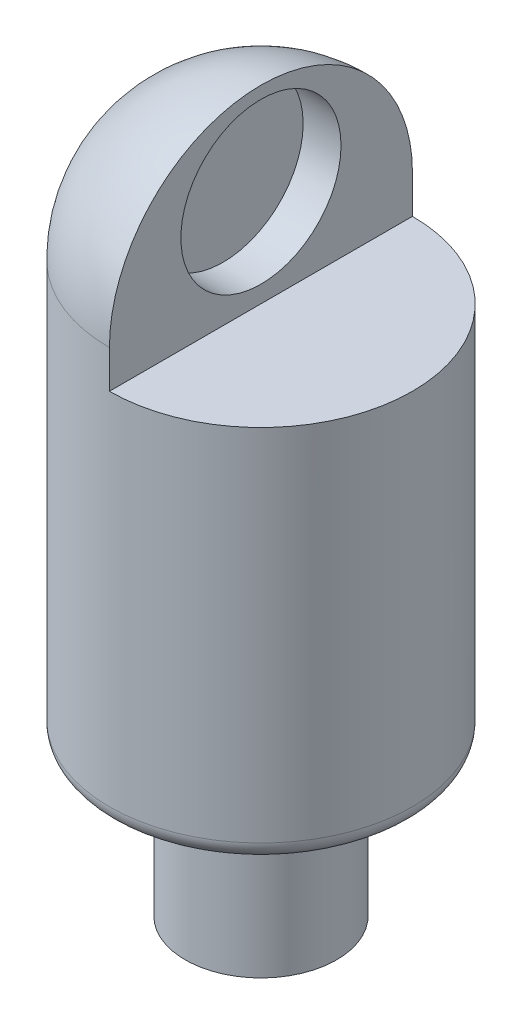
from build123d import *

# Parameters (mm, degrees)
SKETCH1_R           = 40
BOSS_EXTRUDE1_DEPTH = 150
SKETCH2_R           = 20
BOSS_EXTRUDE2_DEPTH = 40
SKETCH3_W           = 40.516071082
SKETCH3_H           = 80
CUT_EXTRUDE1_DEPTH  = 50
SKETCH4_R           = 21.141799796
CUT_EXTRUDE2_DEPTH  = 10
FILLET1_R           = 40
FILLET2_R           = 5


with BuildPart() as part:
    # Sketch1 → Boss-Extrude1 (new body)
    with BuildSketch(Plane(origin=(0, 0, 0), x_dir=(1, 0, 0), z_dir=(0, 1, 0))):
        with Locations(Location((0, 0, 0), (0, 0, 270))):
            Circle(SKETCH1_R)
    extrude(amount=BOSS_EXTRUDE1_DEPTH)

    # Sketch2 → Boss-Extrude2 (add)
    with BuildSketch(Plane.XZ):
        with Locations(Location((0, 0, 0), (0, 0, 270))):
            Circle(SKETCH2_R)
    extrude(amount=BOSS_EXTRUDE2_DEPTH)

    # Sketch3 → Cut-Extrude1 (cut)
    with BuildSketch(Plane(origin=(0, 150, 0), x_dir=(1, 0, 0), z_dir=(0, 1, 0))):
        with Locations((20.258035541, 0)):
            Rectangle(SKETCH3_W, SKETCH3_H)
    extrude(amount=-CUT_EXTRUDE1_DEPTH, mode=Mode.SUBTRACT)

    # Sketch4 → Cut-Extrude2 (cut)
    with BuildSketch(Plane(origin=(0, 0, 0), x_dir=(0, 0, -1), z_dir=(1, 0, 0))):
        with Locations((0, 125.6230245)):
            Circle(SKETCH4_R)
    extrude(amount=-CUT_EXTRUDE2_DEPTH, mode=Mode.SUBTRACT)

    # Fillet1
    fillet1_edges = [part.edges().sort_by_distance(p)[0] for p in [
        (-40, 150, 0),
    ]]
    fillet(fillet1_edges, radius=FILLET1_R - 0.0001)  # a hair under: the kernel refuses the full size

    # Fillet2
    fillet2_edges = [part.edges().sort_by_distance(p)[0] for p in [
        (0, 0, -40),
    ]]
    fillet(fillet2_edges, radius=FILLET2_R)


solid = part.part
